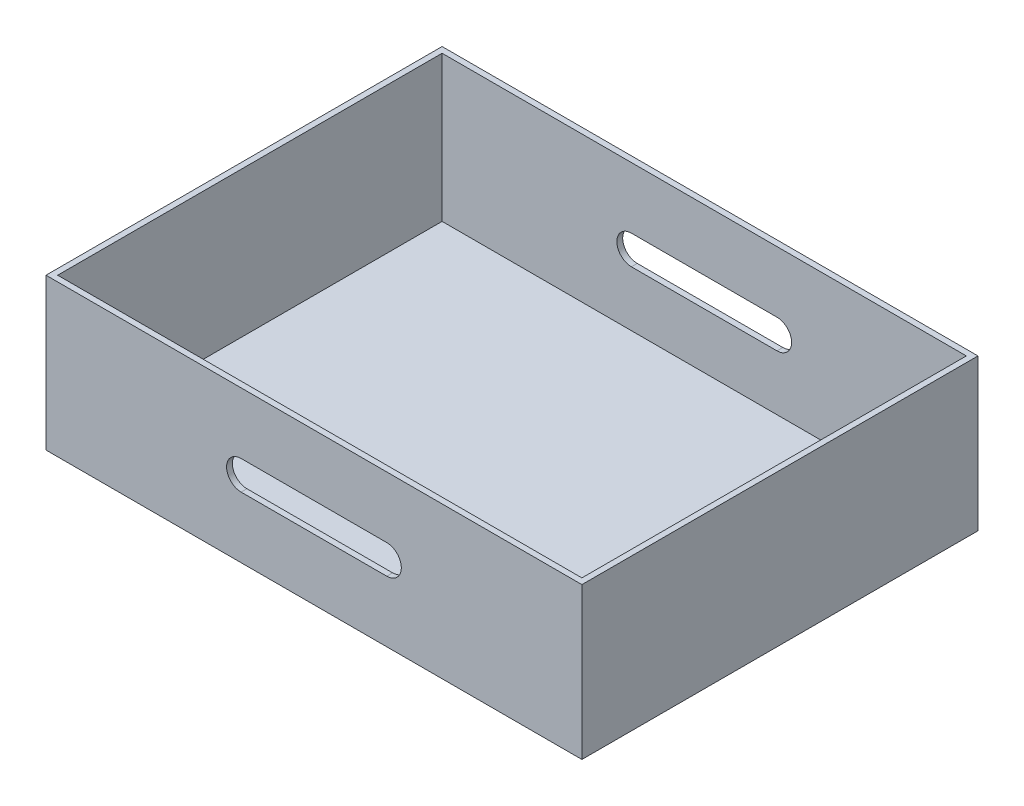
from build123d import *

# Parameters (mm, degrees)
ESBO_O1_W                = 184
ESBO_O1_H                = 136
RESSALTO_EXTRUS_O1_DEPTH = 2
ESBO_O2_W                = 184
ESBO_O2_H                = 136
ESBO_O2_W_2              = 180
ESBO_O2_H_2              = 132
EXTRUS_O_FINA1_DEPTH     = 50
CORTE_EXTRUS_O1_DEPTH    = 173.232401133


with BuildPart() as part:
    # Esboço1 → Ressalto-extrusão1 (new body)
    with BuildSketch(Plane(origin=(0, 0, 0), x_dir=(1, 0, 0), z_dir=(0, 1, 0))):
        Rectangle(ESBO_O1_W, ESBO_O1_H)
    extrude(amount=RESSALTO_EXTRUS_O1_DEPTH)

    # Esboço2 → Extrusão-Fina1 (add)
    with BuildSketch(Plane(origin=(0, 2, 0), x_dir=(1, 0, 0), z_dir=(0, 1, 0))):
        Rectangle(ESBO_O2_W, ESBO_O2_H)
        Rectangle(ESBO_O2_W_2, ESBO_O2_H_2, mode=Mode.SUBTRACT)
    extrude(amount=EXTRUS_O_FINA1_DEPTH)

    # Esboço3 → Corte-extrusão1 (cut, through all)
    with BuildSketch(Plane.XY.offset(68)):
        with BuildLine():
            Line((-25, 31), (25, 31))
            ThreePointArc((25, 31), (30, 26), (25, 21))
            Line((25, 21), (-25, 21))
            ThreePointArc((-25, 21), (-30, 26), (-25, 31))
        make_face()
    extrude(amount=-CORTE_EXTRUS_O1_DEPTH, mode=Mode.SUBTRACT)


solid = part.part
